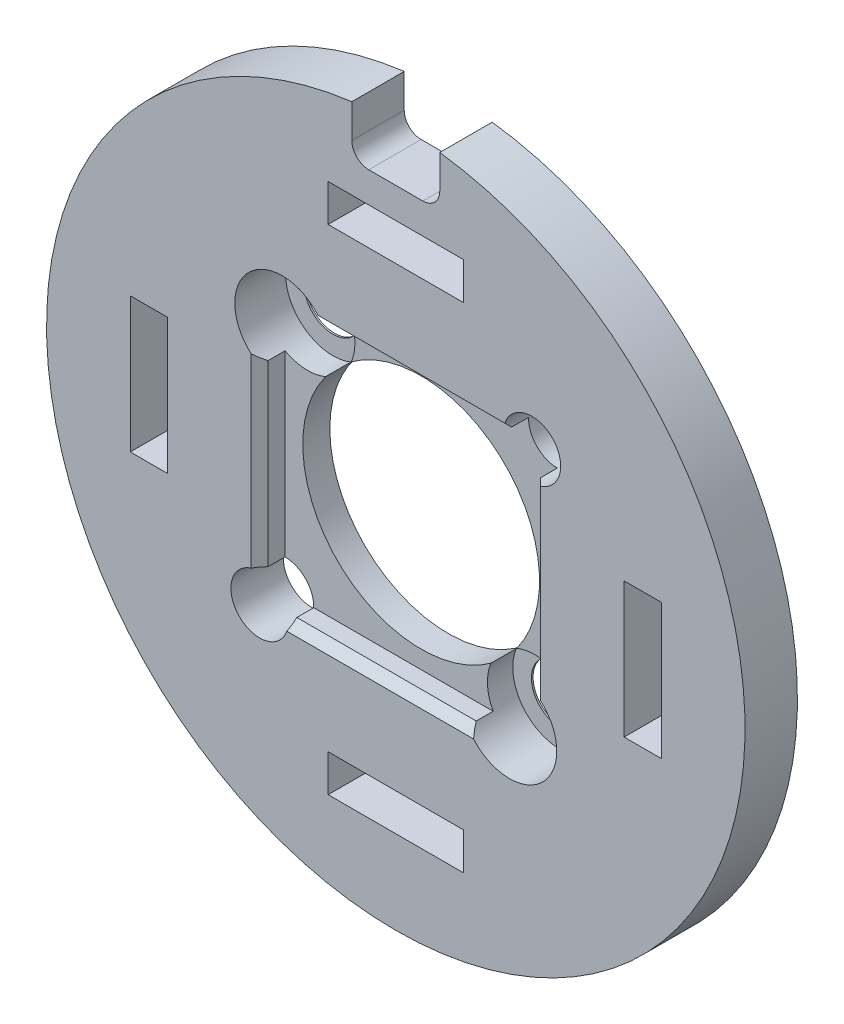
from build123d import *

# Parameters (mm, degrees)
SKETCH_1_R               = 17.4
EXTRUDE_1_DEPTH          = 5.6
SKETCH_2_R               = 1.7
CUT_EXTRUDE_1_DEPTH      = 26.23648153
SKETCH_3_R               = 7
CUT_EXTRUDE_2_DEPTH      = 26.23648153
SKETCH_4_R               = 2.8
CUT_EXTRUDE_3_DEPTH      = 3
SKETCH_5_R               = 1.7
CUT_EXTRUDE_4_DEPTH      = 26.23648153
CUT_EXTRUDE_5_DEPTH      = 2.5
SKETCH_7_W               = 16.1
SKETCH_7_H               = 16.1
CUT_EXTRUDE_6_DEPTH      = 1.5
CHAMFER_1_SIZE           = 0.5
SKETCH_9_W               = 2.2
SKETCH_9_H               = 8
SKETCH_9_W_2             = 8
SKETCH_9_H_2             = 2.2
CUT_EXTRUDE_7_DEPTH      = 26.281613873
BOSS_EXTRUDE1_DEPTH      = 5.6
BOSS_EXTRUDE1_DEPTH_BACK = 4
SKETCH1_R                = 20.65
SKETCH1_R_2              = 17.4
SKETCH3_R                = 23
SKETCH3_R_2              = 20.65
BOSS_EXTRUDE2_DEPTH      = 2.5
SKETCH4_R                = 18
CUT_EXTRUDE3_DEPTH       = 4
SKETCH5_W                = 1
SKETCH5_H                = 8
CUT_EXTRUDE4_DEPTH       = 10
CUT_EXTRUDE6_DEPTH       = 10
FILLET3_R                = 1
SKETCH9_R                = 23
CUT_EXTRUDE8_DEPTH       = 6.5


with BuildPart() as part:
    # 草图1 → 凸台-拉伸1 (new body)
    with BuildSketch(Plane.XY):
        Circle(SKETCH_1_R)
    extrude(amount=EXTRUDE_1_DEPTH)

    # 草图2 → 切除-拉伸1 (cut, through all)
    with BuildSketch(Plane.XY.offset(5.6)):
        with Locations((-6.717514421, 6.717514421)):
            Circle(SKETCH_2_R)
        with Locations((6.717514421, -6.717514421)):
            Circle(SKETCH_2_R)
    extrude(amount=-CUT_EXTRUDE_1_DEPTH, mode=Mode.SUBTRACT)

    # 草图3 → 切除-拉伸2 (cut, through all)
    with BuildSketch(Plane.XY.offset(5.6)):
        Circle(SKETCH_3_R)
    extrude(amount=-CUT_EXTRUDE_2_DEPTH, mode=Mode.SUBTRACT)

    # 草图4 → 切除-拉伸3 (cut)
    with BuildSketch(Plane.XY.offset(5.6)):
        with Locations((-6.717514421, 6.717514421)):
            Circle(SKETCH_4_R)
        with Locations((6.717514421, -6.717514421)):
            Circle(SKETCH_4_R)
    extrude(amount=-CUT_EXTRUDE_3_DEPTH, mode=Mode.SUBTRACT)

    # 草图5 → 切除-拉伸4 (cut, through all)
    with BuildSketch(Plane.XY.offset(5.6)):
        with Locations((8.05, 8)):
            Circle(SKETCH_5_R)
        with Locations((-8.05, -8)):
            Circle(SKETCH_5_R)
    extrude(amount=-CUT_EXTRUDE_4_DEPTH, mode=Mode.SUBTRACT)

    # 草图6 → 切除-拉伸5 (cut)
    with BuildSketch(Plane(origin=(0, 0, 0), x_dir=(-1, 0, 0), z_dir=(0, 0, -1))):
        Polygon((4.766838493, -8), (6.408419246, -10.84330127), (9.691580754, -10.84330127), (11.333161507, -8), (9.691580754, -5.15669873), (6.408419246, -5.15669873), align=None)
        Polygon((-4.766838493, 8), (-6.408419246, 10.84330127), (-9.691580754, 10.84330127), (-11.333161507, 8), (-9.691580754, 5.15669873), (-6.408419246, 5.15669873), align=None)
    extrude(amount=-CUT_EXTRUDE_5_DEPTH, mode=Mode.SUBTRACT)

    # 草图7 → 切除-拉伸6 (cut)
    with BuildSketch(Plane.XY.offset(5.6)):
        Rectangle(SKETCH_7_W, SKETCH_7_H)
    extrude(amount=-CUT_EXTRUDE_6_DEPTH, mode=Mode.SUBTRACT)

    # 倒角1
    chamfer_1_edges = [part.edges().sort_by_distance(p)[0] for p in [
        (8.05, 1.022551258, 5.6),
        (1.047918985, 8.05, 5.6),
        (-8.05, -1.022551258, 5.6),
        (-1.047918985, -8.05, 5.6),
    ]]
    chamfer(chamfer_1_edges, length=CHAMFER_1_SIZE)

    # 草图8 → 旋转1 (revolve)
    with BuildSketch(Plane(origin=(0, 0, 0), x_dir=(0, 0, -1), z_dir=(1, 0, 0)), mode=Mode.PRIVATE) as revolve_1_sk:
        Polygon((0, 17.4), (0, 17.2), (0.2, 17.4), align=None)
    revolve(revolve_1_sk.sketch.rotate(Axis((0, 0, 0), (0, 0, 1)), 90), axis=Axis((0, 0, 0), (0, 0, 1)))

    # 草图9 → 切除-拉伸7 (cut, through all)
    with BuildSketch(Plane.XY.offset(5.6)):
        with Locations((14.6, 0)):
            Rectangle(SKETCH_9_W, SKETCH_9_H)
        with Locations((0, 14.6)):
            Rectangle(SKETCH_9_W_2, SKETCH_9_H_2)
        with Locations((-14.6, 0)):
            Rectangle(SKETCH_9_W, SKETCH_9_H)
        with Locations((0, -14.6)):
            Rectangle(SKETCH_9_W_2, SKETCH_9_H_2)
    extrude(amount=-CUT_EXTRUDE_7_DEPTH, mode=Mode.SUBTRACT)

    # Sketch1 → Boss-Extrude1 (add, two sides: drawn at the far end of the back side and taken through both)
    with BuildSketch(Plane.XY.offset(-BOSS_EXTRUDE1_DEPTH_BACK)):
        Circle(SKETCH1_R)
        Circle(SKETCH1_R_2, mode=Mode.SUBTRACT)
    extrude(amount=BOSS_EXTRUDE1_DEPTH + BOSS_EXTRUDE1_DEPTH_BACK)

    # Sketch3 → Boss-Extrude2 (add)
    with BuildSketch(Plane(origin=(0, 0, -4), x_dir=(-1, 0, 0), z_dir=(0, 0, -1))):
        Circle(SKETCH3_R)
        with Locations(Location((0, 0, 0), (0, 0, 180))):
            Circle(SKETCH3_R_2, mode=Mode.SUBTRACT)
    extrude(amount=-BOSS_EXTRUDE2_DEPTH)

    # Sketch4 → Cut-Extrude3 (cut)
    with BuildSketch(Plane(origin=(0, 0, -4), x_dir=(-1, 0, 0), z_dir=(0, 0, -1))):
        Circle(SKETCH4_R)
    extrude(amount=-CUT_EXTRUDE3_DEPTH, mode=Mode.SUBTRACT)

    # Sketch5 → Cut-Extrude4 (cut)
    with BuildSketch(Plane(origin=(0, 0, -4), x_dir=(-1, 0, 0), z_dir=(0, 0, -1))):
        with Locations((22.5, 0)):
            Rectangle(SKETCH5_W, SKETCH5_H)
        with Locations((-22.5, 0)):
            Rectangle(SKETCH5_W, SKETCH5_H)
    extrude(amount=-CUT_EXTRUDE4_DEPTH, mode=Mode.SUBTRACT)

    # Sketch7 → Cut-Extrude6 (cut)
    with BuildSketch(Plane(origin=(0, 0, -4), x_dir=(-1, 0, 0), z_dir=(0, 0, -1))):
        with BuildLine():
            Line((0, 18), (0, 22.3))
            Line((0, 22.3), (-2.6, 22.3))
            Line((-2.6, 22.3), (-2.6, 17.811232411))
            ThreePointArc((-2.6, 17.811232411), (-1.303421766, 17.952746077), (0, 18))
        make_face()
        with BuildLine():
            Line((0, 17.5), (0, 18))
            ThreePointArc((0, 18), (-1.303421766, 17.952746077), (-2.6, 17.811232411))
            Line((-2.6, 17.811232411), (-2.6, 17.5))
            Line((-2.6, 17.5), (0, 17.5))
        make_face()
        with BuildLine():
            Line((2.6, 22.3), (0, 22.3))
            Line((0, 22.3), (0, 18))
            ThreePointArc((0, 18), (1.303421766, 17.952746077), (2.6, 17.811232411))
            Line((2.6, 17.811232411), (2.6, 22.3))
        make_face()
        with BuildLine():
            ThreePointArc((2.6, 17.811232411), (1.303421766, 17.952746077), (0, 18))
            Line((0, 18), (0, 17.5))
            Line((0, 17.5), (2.6, 17.5))
            Line((2.6, 17.5), (2.6, 17.811232411))
        make_face()
    extrude(amount=-CUT_EXTRUDE6_DEPTH, mode=Mode.SUBTRACT)

    # Fillet3
    # the kernel refuses this fillet: 1 mm, written as the material it adds along each edge
    with BuildSketch(Plane(origin=(2.6, 22.3, -4), x_dir=(-1, 0, 0), z_dir=(0, 0, 1))) as fillet3_piece_1:
        with BuildLine():
            CenterArc((FILLET3_R, FILLET3_R), FILLET3_R, 180, 90)
            Line((0, FILLET3_R), (-FILLET3_R * 0.02, FILLET3_R))
            Line((-FILLET3_R * 0.02, FILLET3_R), (-FILLET3_R * 0.02, -FILLET3_R * 0.02))
            Line((-FILLET3_R * 0.02, -FILLET3_R * 0.02), (FILLET3_R, -FILLET3_R * 0.02))
            Line((FILLET3_R, -FILLET3_R * 0.02), (FILLET3_R, 0))
        make_face()
    extrude(amount=2.5)
    with BuildSketch(Plane(origin=(-2.6, 22.3, -4), x_dir=(1, 0, 0), z_dir=(0, 0, 1))) as fillet3_piece_2:
        with BuildLine():
            CenterArc((FILLET3_R, -FILLET3_R), FILLET3_R, 90, 90)
            Line((0, -FILLET3_R), (-FILLET3_R * 0.02, -FILLET3_R))
            Line((-FILLET3_R * 0.02, -FILLET3_R), (-FILLET3_R * 0.02, FILLET3_R * 0.02))
            Line((-FILLET3_R * 0.02, FILLET3_R * 0.02), (FILLET3_R, FILLET3_R * 0.02))
            Line((FILLET3_R, FILLET3_R * 0.02), (FILLET3_R, 0))
        make_face()
    extrude(amount=2.5)
    with BuildSketch(Plane(origin=(-2.6, 17.5, -6), x_dir=(0, 1, 0), z_dir=(0, 0, 1))) as fillet3_piece_3_section:
        with BuildLine():
            CenterArc((FILLET3_R, -FILLET3_R), FILLET3_R, 90, 90)
            Line((0, -FILLET3_R), (-FILLET3_R * 0.02, -FILLET3_R))
            Line((-FILLET3_R * 0.02, -FILLET3_R), (-FILLET3_R * 0.02, FILLET3_R * 0.02))
            Line((-FILLET3_R * 0.02, FILLET3_R * 0.02), (FILLET3_R, FILLET3_R * 0.02))
            Line((FILLET3_R, FILLET3_R * 0.02), (FILLET3_R, 0))
        make_face()
    fillet3_piece_3 = extrude(amount=11.6, mode=Mode.PRIVATE)
    fillet3_piece_3 = split(fillet3_piece_3, bisect_by=Plane(origin=(-2.544482942, 18.024809788, 0), z_dir=(0, 0, -1)), keep=Keep.TOP, mode=Mode.PRIVATE)
    fillet3_piece_3 = fillet3_piece_3 - Plane(origin=(0, 0, -2), x_dir=(-1, 0, 0), z_dir=(0, 0, -1)) * Cylinder(18, 28, mode=Mode.PRIVATE)
    fillet3_piece_3 = split(fillet3_piece_3, bisect_by=Plane(origin=(-2.544482942, 18.024809788, -4), z_dir=(0, 0, 1)), keep=Keep.TOP, mode=Mode.PRIVATE)
    add(fillet3_piece_3)
    with BuildSketch(Plane(origin=(-2.6, 17.5, 0), x_dir=(0, 1, 0), z_dir=(0, 0, 1))) as fillet3_piece_4_section:
        with BuildLine():
            CenterArc((FILLET3_R, -FILLET3_R), FILLET3_R, 90, 90)
            Line((0, -FILLET3_R), (-FILLET3_R * 0.02, -FILLET3_R))
            Line((-FILLET3_R * 0.02, -FILLET3_R), (-FILLET3_R * 0.02, FILLET3_R * 0.02))
            Line((-FILLET3_R * 0.02, FILLET3_R * 0.02), (FILLET3_R, FILLET3_R * 0.02))
            Line((FILLET3_R, FILLET3_R * 0.02), (FILLET3_R, 0))
        make_face()
    fillet3_piece_4 = extrude(amount=5.6, mode=Mode.PRIVATE)
    fillet3_piece_4 = fillet3_piece_4 - Plane(origin=(0, 0, 2.8), x_dir=(-1, 0, 0), z_dir=(0, 0, -1)) * Cylinder(18, 16, mode=Mode.PRIVATE)
    add(fillet3_piece_4)
    with BuildSketch(Plane(origin=(-2.6, 17.5, 0), x_dir=(0, 1, 0), z_dir=(0, 0, 1))) as fillet3_piece_5_section:
        with BuildLine():
            CenterArc((FILLET3_R, -FILLET3_R), FILLET3_R, 90, 90)
            Line((0, -FILLET3_R), (-FILLET3_R * 0.02, -FILLET3_R))
            Line((-FILLET3_R * 0.02, -FILLET3_R), (-FILLET3_R * 0.02, FILLET3_R * 0.02))
            Line((-FILLET3_R * 0.02, FILLET3_R * 0.02), (FILLET3_R, FILLET3_R * 0.02))
            Line((FILLET3_R, FILLET3_R * 0.02), (FILLET3_R, 0))
        make_face()
    fillet3_piece_5 = extrude(amount=5.6, mode=Mode.PRIVATE)
    fillet3_piece_5 = fillet3_piece_5 & Plane(origin=(0, 0, 2.8), x_dir=(-1, 0, 0), z_dir=(0, 0, -1)) * Cylinder(18, 16, mode=Mode.PRIVATE)
    add(fillet3_piece_5)
    with BuildSketch(Plane(origin=(2.6, 17.5, -6), x_dir=(-1, 0, 0), z_dir=(0, 0, 1))) as fillet3_piece_6_section:
        with BuildLine():
            CenterArc((FILLET3_R, -FILLET3_R), FILLET3_R, 90, 90)
            Line((0, -FILLET3_R), (-FILLET3_R * 0.02, -FILLET3_R))
            Line((-FILLET3_R * 0.02, -FILLET3_R), (-FILLET3_R * 0.02, FILLET3_R * 0.02))
            Line((-FILLET3_R * 0.02, FILLET3_R * 0.02), (FILLET3_R, FILLET3_R * 0.02))
            Line((FILLET3_R, FILLET3_R * 0.02), (FILLET3_R, 0))
        make_face()
    fillet3_piece_6 = extrude(amount=11.6, mode=Mode.PRIVATE)
    fillet3_piece_6 = split(fillet3_piece_6, bisect_by=Plane(origin=(2.544482942, 18.024809788, 0), z_dir=(0, 0, -1)), keep=Keep.TOP, mode=Mode.PRIVATE)
    fillet3_piece_6 = fillet3_piece_6 - Plane(origin=(0, 0, -2), x_dir=(-1, 0, 0), z_dir=(0, 0, -1)) * Cylinder(18, 28, mode=Mode.PRIVATE)
    fillet3_piece_6 = split(fillet3_piece_6, bisect_by=Plane(origin=(2.544482942, 18.024809788, -4), z_dir=(0, 0, 1)), keep=Keep.TOP, mode=Mode.PRIVATE)
    add(fillet3_piece_6)
    with BuildSketch(Plane(origin=(2.6, 17.5, 0), x_dir=(-1, 0, 0), z_dir=(0, 0, 1))) as fillet3_piece_7_section:
        with BuildLine():
            CenterArc((FILLET3_R, -FILLET3_R), FILLET3_R, 90, 90)
            Line((0, -FILLET3_R), (-FILLET3_R * 0.02, -FILLET3_R))
            Line((-FILLET3_R * 0.02, -FILLET3_R), (-FILLET3_R * 0.02, FILLET3_R * 0.02))
            Line((-FILLET3_R * 0.02, FILLET3_R * 0.02), (FILLET3_R, FILLET3_R * 0.02))
            Line((FILLET3_R, FILLET3_R * 0.02), (FILLET3_R, 0))
        make_face()
    fillet3_piece_7 = extrude(amount=5.6, mode=Mode.PRIVATE)
    fillet3_piece_7 = fillet3_piece_7 & Plane(origin=(0, 0, 2.8), x_dir=(-1, 0, 0), z_dir=(0, 0, -1)) * Cylinder(18, 16, mode=Mode.PRIVATE)
    add(fillet3_piece_7)
    with BuildSketch(Plane(origin=(2.6, 17.5, 0), x_dir=(-1, 0, 0), z_dir=(0, 0, 1))) as fillet3_piece_8_section:
        with BuildLine():
            CenterArc((FILLET3_R, -FILLET3_R), FILLET3_R, 90, 90)
            Line((0, -FILLET3_R), (-FILLET3_R * 0.02, -FILLET3_R))
            Line((-FILLET3_R * 0.02, -FILLET3_R), (-FILLET3_R * 0.02, FILLET3_R * 0.02))
            Line((-FILLET3_R * 0.02, FILLET3_R * 0.02), (FILLET3_R, FILLET3_R * 0.02))
            Line((FILLET3_R, FILLET3_R * 0.02), (FILLET3_R, 0))
        make_face()
    fillet3_piece_8 = extrude(amount=5.6, mode=Mode.PRIVATE)
    fillet3_piece_8 = fillet3_piece_8 - Plane(origin=(0, 0, 2.8), x_dir=(-1, 0, 0), z_dir=(0, 0, -1)) * Cylinder(18, 16, mode=Mode.PRIVATE)
    add(fillet3_piece_8)

    # Sketch9 → Cut-Extrude8 (cut)
    with BuildSketch(Plane(origin=(0, 0, -4), x_dir=(-1, 0, 0), z_dir=(0, 0, -1))):
        Circle(SKETCH9_R)
    extrude(amount=-CUT_EXTRUDE8_DEPTH, mode=Mode.SUBTRACT)


solid = part.part
